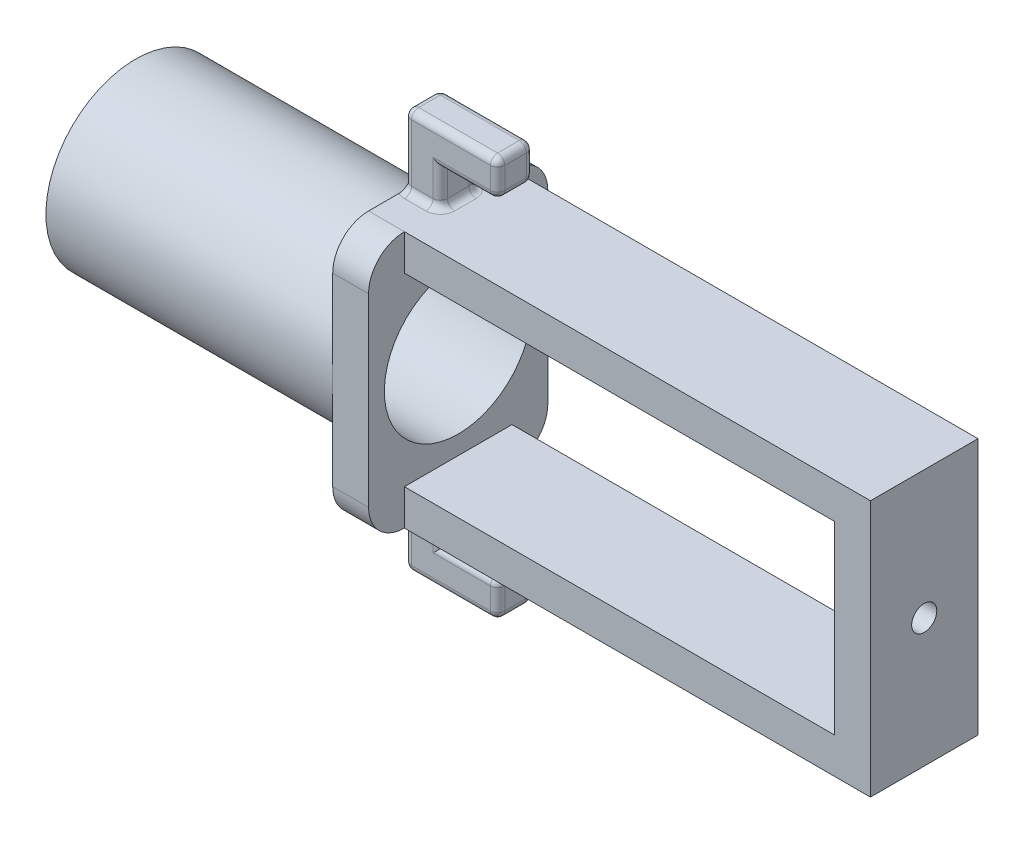
from build123d import *

# Parameters (mm, degrees)
SKETCH1_W            = 70
SKETCH1_H            = 35.8
SKETCH1_W_2          = 60
SKETCH1_H_2          = 25.8
BOSS_EXTRUDE1_DEPTH  = 25
CUT_EXTRUDE4_REACH   = 78.455
SKETCH2_R            = 10.3
CUT_EXTRUDE5_REACH   = 78.455
SKETCH3_R            = 1.75
BOSS_EXTRUDE2_START  = 40
SKETCH4_R            = 12.5
SKETCH4_R_2          = 10.3
BOSS_EXTRUDE2_DEPTH  = 40
SKETCH8_W            = 5
SKETCH8_H            = 5
BOSS_EXTRUDE4_DEPTH  = 10
SKETCH11_W           = 5
SKETCH11_H           = 5
BOSS_EXTRUDE5_DEPTH  = 8
FILLET3_R            = 1
FILLET3_OF_MIRROR2_R = 1
FILLET5_START        = -35
FILLET5_DEPTH        = 71
FILLET6_R            = 1
FILLET7_R            = 1
FILLET8_R            = 1
FILLET9_R            = 1
FILLET10_R           = 2
SKETCH16_W           = 65
SKETCH16_H           = 5
CUT_EXTRUDE8_DEPTH   = 92.365420182


with BuildPart() as part:
    # Sketch1 → Boss-Extrude1 (new body)
    with BuildSketch(Plane.XY):
        Rectangle(SKETCH1_W, SKETCH1_H)
        Rectangle(SKETCH1_W_2, SKETCH1_H_2, mode=Mode.SUBTRACT)
    extrude(amount=BOSS_EXTRUDE1_DEPTH)

    # Sketch2 → Cut-Extrude4 (cut, up to next)
    with BuildSketch(Plane.ZY.offset(35), mode=Mode.PRIVATE) as cut_extrude4_sk1:
        with Locations(Location((12.5, 0, 0), (0, 0, 270))):
            Circle(SKETCH2_R)
    cut_extrude4_tool1 = extrude(cut_extrude4_sk1.sketch, amount=-CUT_EXTRUDE4_REACH, mode=Mode.PRIVATE) & part.part
    add(cut_extrude4_tool1.solids().sort_by_distance((-35, 0, 12.5))[0], mode=Mode.SUBTRACT)

    # Sketch3 → Cut-Extrude5 (cut, up to next)
    with BuildSketch(Plane(origin=(35, 0, 0), x_dir=(0, 0, -1), z_dir=(1, 0, 0)), mode=Mode.PRIVATE) as cut_extrude5_sk1:
        with Locations(Location((-12.5, 0, 0), (0, 0, 90))):
            Circle(SKETCH3_R)
    cut_extrude5_tool1 = extrude(cut_extrude5_sk1.sketch, amount=-CUT_EXTRUDE5_REACH, mode=Mode.PRIVATE) & part.part
    add(cut_extrude5_tool1.solids().sort_by_distance((35, 0, 12.5))[0], mode=Mode.SUBTRACT)

    # Sketch4 → Boss-Extrude2 (add)
    with BuildSketch(Plane.ZY.offset(35).offset(BOSS_EXTRUDE2_START)):
        with Locations(Location((12.5, 0, 0), (0, 0, 180))):
            Circle(SKETCH4_R)
        with Locations(Location((12.5, 0, 0), (0, 0, 270))):
            Circle(SKETCH4_R_2, mode=Mode.SUBTRACT)
    extrude(amount=-BOSS_EXTRUDE2_DEPTH)

    # Sketch8 → Boss-Extrude4 (add)
    with BuildSketch(Plane(origin=(0, 17.9, 0), x_dir=(1, 0, 0), z_dir=(0, 1, 0))):
        with Locations((-32.5, -12.5)):
            Rectangle(SKETCH8_W, SKETCH8_H)
    boss_extrude4 = extrude(amount=BOSS_EXTRUDE4_DEPTH)

    # Sketch11 → Boss-Extrude5 (add)
    with BuildSketch(Plane(origin=(-30, 0, 0), x_dir=(0, 0, -1), z_dir=(1, 0, 0))):
        with Locations((-12.5, 25.4)):
            Rectangle(SKETCH11_W, SKETCH11_H)
    boss_extrude5 = extrude(amount=BOSS_EXTRUDE5_DEPTH)

    # Fillet3
    fillet3_edges = [part.edges().sort_by_distance(p)[0] for p in [
        (-35, 22.9, 10),
        (-35, 22.9, 15),
        (-28.5, 27.9, 15),
        (-28.5, 27.9, 10),
        (-30, 20.4, 10),
        (-30, 20.4, 15),
        (-26, 22.9, 15),
        (-26, 22.9, 10),
    ]]
    fillet(fillet3_edges, radius=FILLET3_R)

    # Mirror2: Boss-Extrude4, Boss-Extrude5 across plane
    add(boss_extrude4.mirror(Plane.ZX))
    add(boss_extrude5.mirror(Plane.ZX))

    # Fillet3 of Mirror2
    fillet3_of_mirror2_edges = [part.edges().sort_by_distance(p)[0] for p in [
        (-35, -22.9, 10),
        (-35, -22.9, 15),
        (-28.5, -27.9, 15),
        (-28.5, -27.9, 10),
        (-30, -20.4, 10),
        (-30, -20.4, 15),
        (-26, -22.9, 15),
        (-26, -22.9, 10),
    ]]
    fillet(fillet3_of_mirror2_edges, radius=FILLET3_OF_MIRROR2_R)

    # Fillet5: read off the stored shape, not the designer's step
    # Fillet5 outline → Fillet5 (cut)
    with BuildSketch(Plane.YZ.offset(FILLET5_START)):
        with BuildLine():
            ThreePointArc((12.9, 25), (16.435533906, 23.535533906), (17.9, 20))
            Line((17.9, 20), (17.9, 25))
            Line((17.9, 25), (12.9, 25))
        make_face()
        with BuildLine():
            Line((17.9, 0), (17.9, 5))
            ThreePointArc((17.9, 5), (16.435533906, 1.464466094), (12.9, 0))
            Line((12.9, 0), (17.9, 0))
        make_face()
        with BuildLine():
            ThreePointArc((-17.9, 20), (-16.435533906, 23.535533906), (-12.9, 25))
            Line((-12.9, 25), (-17.9, 25))
            Line((-17.9, 25), (-17.9, 20))
        make_face()
        with BuildLine():
            Line((-17.9, 0), (-12.9, 0))
            ThreePointArc((-12.9, 0), (-16.435533906, 1.464466094), (-17.9, 5))
            Line((-17.9, 5), (-17.9, 0))
        make_face()
    extrude(amount=FILLET5_DEPTH, mode=Mode.SUBTRACT)

    # Fillet6
    fillet6_edges = [part.edges().sort_by_distance(p)[0] for p in [
        (-22, -25.4, 10),
        (-22, -22.9, 12.5),
        (-22, -25.4, 15),
        (-22, -27.9, 12.5),
        (-22, -23.192893219, 14.707106781),
        (-22, -27.607106781, 14.707106781),
        (-22, -27.607106781, 10.292893219),
        (-22, -23.192893219, 10.292893219),
    ]]
    fillet(fillet6_edges, radius=FILLET6_R)

    # Fillet7
    fillet7_edges = [part.edges().sort_by_distance(p)[0] for p in [
        (-22, 25.4, 10),
        (-22, 22.9, 12.5),
        (-22, 25.4, 15),
        (-22, 27.9, 12.5),
        (-22, 23.192893219, 14.707106781),
        (-22, 27.607106781, 14.707106781),
        (-22, 27.607106781, 10.292893219),
        (-22, 23.192893219, 10.292893219),
    ]]
    fillet(fillet7_edges, radius=FILLET7_R)

    # Fillet8
    # the kernel refuses this fillet: 1 mm, written as the material it takes off along each edge
    with BuildSketch(Plane(origin=(-34, 26.9, 11), x_dir=(-1, 0, 0), z_dir=(0, 1, 0))) as fillet8_piece_1_section:
        Polygon((0, 0), (FILLET8_R, 0), (FILLET8_R, -FILLET8_R), (0, -FILLET8_R), align=None)
    fillet8_piece_1 = extrude(amount=FILLET8_R, mode=Mode.PRIVATE)
    fillet8_piece_1 = fillet8_piece_1 - Plane(origin=(-34, 26.9, 11), x_dir=(0.7071067811865475, 0, 0.7071067811865475), z_dir=(0, 1, 0)) * Sphere(FILLET8_R, mode=Mode.PRIVATE)
    add(fillet8_piece_1, mode=Mode.SUBTRACT)
    with BuildSketch(Plane(origin=(-34, 26.9, 14), x_dir=(-1, 0, 0), z_dir=(0, 1, 0))) as fillet8_piece_2_section:
        Polygon((0, 0), (FILLET8_R, 0), (FILLET8_R, FILLET8_R), (0, FILLET8_R), align=None)
    fillet8_piece_2 = extrude(amount=FILLET8_R, mode=Mode.PRIVATE)
    fillet8_piece_2 = fillet8_piece_2 - Plane(origin=(-34, 26.9, 14), x_dir=(0.7071067811865475, 0, -0.7071067811865475), z_dir=(0, 1, 0)) * Sphere(FILLET8_R, mode=Mode.PRIVATE)
    add(fillet8_piece_2, mode=Mode.SUBTRACT)
    with BuildSketch(Plane(origin=(-34, -26.9, 11), x_dir=(0, -1, 0), z_dir=(-1, 0, 0))) as fillet8_piece_3_section:
        Polygon((0, 0), (FILLET8_R, 0), (FILLET8_R, -FILLET8_R), (0, -FILLET8_R), align=None)
    fillet8_piece_3 = extrude(amount=FILLET8_R, mode=Mode.PRIVATE)
    fillet8_piece_3 = fillet8_piece_3 - Plane(origin=(-34, -26.9, 11), x_dir=(0, 0.7071067811865475, 0.7071067811865475), z_dir=(-1, 0, 0)) * Sphere(FILLET8_R, mode=Mode.PRIVATE)
    add(fillet8_piece_3, mode=Mode.SUBTRACT)
    with BuildSketch(Plane(origin=(-34, -26.9, 14), x_dir=(0, -1, 0), z_dir=(-1, 0, 0))) as fillet8_piece_4_section:
        Polygon((0, 0), (FILLET8_R, 0), (FILLET8_R, FILLET8_R), (0, FILLET8_R), align=None)
    fillet8_piece_4 = extrude(amount=FILLET8_R, mode=Mode.PRIVATE)
    fillet8_piece_4 = fillet8_piece_4 - Plane(origin=(-34, -26.9, 14), x_dir=(0, 0.7071067811865475, -0.7071067811865475), z_dir=(-1, 0, 0)) * Sphere(FILLET8_R, mode=Mode.PRIVATE)
    add(fillet8_piece_4, mode=Mode.SUBTRACT)
    with BuildSketch(Plane(origin=(-35, -27.9, 11), x_dir=(0, 1, 0), z_dir=(0, 0, 1)), Plane(origin=(-35, 27.9, 11), x_dir=(1, 0, 0), z_dir=(0, 0, 1))) as fillet8_piece_5:
        with BuildLine():
            CenterArc((FILLET8_R, -FILLET8_R), FILLET8_R, 90, 90)
            Line((0, -FILLET8_R), (0, 0))
            Line((0, 0), (FILLET8_R, 0))
        make_face()
    extrude(amount=3, mode=Mode.SUBTRACT)

    # Fillet9
    # the kernel refuses this fillet: 1 mm, written as the material it adds along each edge
    with BuildSketch(Plane(origin=(-31, 17.9, 10), x_dir=(0, 1, 0), z_dir=(-1, 0, 0)), Plane(origin=(-34, 17.9, 15), x_dir=(0, 1, 0), z_dir=(1, 0, 0))) as fillet9_piece_1:
        with BuildLine():
            CenterArc((FILLET9_R, FILLET9_R), FILLET9_R, 180, 90)
            Line((0, FILLET9_R), (0, 0))
            Line((0, 0), (FILLET9_R, 0))
        make_face()
    extrude(amount=3)
    with BuildSketch(Plane(origin=(-30, 17.9, 14), x_dir=(1, 0, 0), z_dir=(0, 0, -1))) as fillet9_piece_2:
        with BuildLine():
            CenterArc((FILLET9_R, -FILLET9_R), FILLET9_R, 90, 90)
            Line((0, -FILLET9_R), (0, 0))
            Line((0, 0), (FILLET9_R, 0))
        make_face()
    extrude(amount=3)
    with BuildSketch(Plane(origin=(-34, 17.9, 11), x_dir=(0, 0, -1), z_dir=(1, 0, 0))) as fillet9_piece_3_section:
        with BuildLine():
            CenterArc((1 + FILLET9_R, FILLET9_R), FILLET9_R, 180, 90)
            Line((1, FILLET9_R), (1, 0))
            Line((1, 0), (1 + FILLET9_R, 0))
        make_face()
    fillet9_piece_3 = revolve(axis=Axis((-34, 17.9, 11), (0, 1, 0)), revolution_arc=233.296989237, mode=Mode.PRIVATE)
    fillet9_piece_3 = split(fillet9_piece_3, bisect_by=Plane(origin=(-35, 17.9, 11), z_dir=(1, 0, 0)), keep=Keep.TOP, mode=Mode.PRIVATE)
    add(fillet9_piece_3)
    with BuildSketch(Plane(origin=(-31, 17.9, 11), x_dir=(0, 0, -1), z_dir=(-1, 0, 0))) as fillet9_piece_4:
        with BuildLine():
            CenterArc((1 + FILLET9_R, -FILLET9_R), FILLET9_R, 90, 90)
            Line((1, -FILLET9_R), (1, 0))
            Line((1, 0), (1 + FILLET9_R, 0))
        make_face()
    revolve(axis=Axis((-31, 17.9, 11), (0, -1, 0)), revolution_arc=90)
    with BuildSketch(Plane(origin=(-34, 17.9, 14), x_dir=(0, 0, 1), z_dir=(1, 0, 0))) as fillet9_piece_5_section:
        with BuildLine():
            CenterArc((1 + FILLET9_R, -FILLET9_R), FILLET9_R, 90, 90)
            Line((1 + FILLET9_R, 0), (1, 0))
            Line((1, 0), (1, -FILLET9_R))
        make_face()
    fillet9_piece_5 = revolve(axis=Axis((-34, 17.9, 14), (0, -1, 0)), revolution_arc=233.296989237, mode=Mode.PRIVATE)
    fillet9_piece_5 = split(fillet9_piece_5, bisect_by=Plane(origin=(-35, 17.9, 14), z_dir=(1, 0, 0)), keep=Keep.TOP, mode=Mode.PRIVATE)
    add(fillet9_piece_5)
    with BuildSketch(Plane(origin=(-31, 17.9, 14), x_dir=(1, 0, 0), z_dir=(0, 0, -1))) as fillet9_piece_6:
        with BuildLine():
            CenterArc((1 + FILLET9_R, -FILLET9_R), FILLET9_R, 90, 90)
            Line((1 + FILLET9_R, 0), (1, 0))
            Line((1, 0), (1, -FILLET9_R))
        make_face()
    revolve(axis=Axis((-31, 17.9, 14), (0, -1, 0)), revolution_arc=90)

    # Fillet10
    fillet10_edges = [part.edges().sort_by_distance(p)[0] for p in [
        (-32.5, -17.9, 10),
        (-30, -17.9, 12.5),
        (-32.5, -17.9, 15),
        (-34.707106781, -17.9, 10.292893219),
        (-30.292893219, -17.9, 10.292893219),
        (-34.707106781, -17.9, 14.707106781),
        (-30.292893219, -17.9, 14.707106781),
    ]]
    fillet(fillet10_edges, radius=FILLET10_R)

    # Sketch16 → Cut-Extrude8 (cut, through all)
    with BuildSketch(Plane.XZ.offset(17.9)):
        with Locations((2.5, 22.5)):
            Rectangle(SKETCH16_W, SKETCH16_H)
        with Locations((2.5, 2.5)):
            Rectangle(SKETCH16_W, SKETCH16_H)
    extrude(amount=-CUT_EXTRUDE8_DEPTH, mode=Mode.SUBTRACT)


solid = part.part
